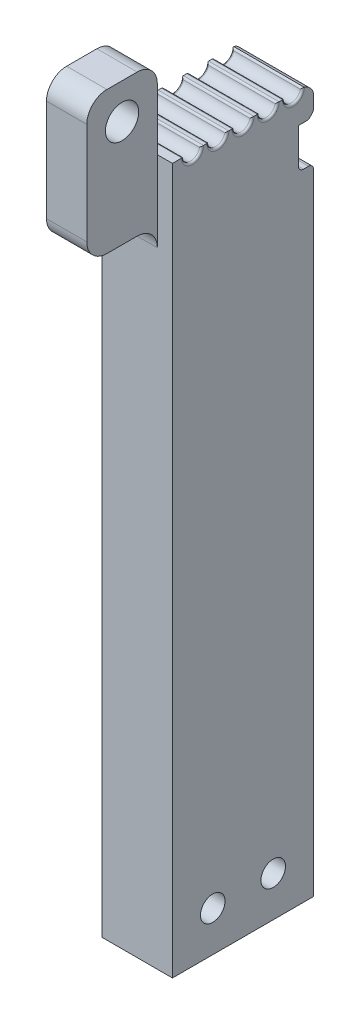
from build123d import *

# Parameters (mm, degrees)
SKETCH1_W                                      = 7
SKETCH1_H                                      = 14
BOSS_EXTRUDE1_DEPTH                            = 70
CBORE_FOR_2_SOCKET_HEAD_CAP_SCREW1_D           = 2.4384
CBORE_FOR_2_SOCKET_HEAD_CAP_SCREW1_CBORE_D     = 4.7625
CBORE_FOR_2_SOCKET_HEAD_CAP_SCREW1_CBORE_DEPTH = 2.1844
CUT_EXTRUDE2_DEPTH                             = 71.696534569
LPATTERN1_COUNT                                = 3
LPATTERN1_PITCH                                = 2.5
LPATTERN1_COL_COUNT                            = 3
LPATTERN1_COL_PITCH                            = 2.5
FILLET1_R                                      = 0.2
CHAMFER1_SIZE                                  = 0.7
FILLET2_R                                      = 1
CUT_EXTRUDE4_DEPTH                             = 71.436141406
CUT_EXTRUDE4_DEPTH_BACK                        = 71.436141406
SKETCH6_W                                      = 1.5
SKETCH6_H                                      = 4
CHAMFER2_SIZE                                  = 0.5
FILLET4_R                                      = 0.5
SKETCH7_W                                      = 7
SKETCH7_H                                      = 14.1
BOSS_EXTRUDE2_DEPTH                            = 2
CUT_EXTRUDE5_REACH                             = 81.535
SKETCH9_R                                      = 1.65
FILLET5_R                                      = 2


with BuildPart() as part:
    # Sketch1 → Boss-Extrude1 (new body)
    with BuildSketch(Plane(origin=(0, 0, 0), x_dir=(1, 0, 0), z_dir=(0, 1, 0))):
        Rectangle(SKETCH1_W, SKETCH1_H)
    extrude(amount=BOSS_EXTRUDE1_DEPTH)

    # CBORE for #2 Socket Head Cap Screw1 (through all)
    with Locations(Plane(origin=(-3.5, 0, 0), x_dir=(0, 0, -1), z_dir=(-1, 0, 0))):
        with Locations((-3, -4), (3, -4)):
            CounterBoreHole(CBORE_FOR_2_SOCKET_HEAD_CAP_SCREW1_D / 2, CBORE_FOR_2_SOCKET_HEAD_CAP_SCREW1_CBORE_D / 2, CBORE_FOR_2_SOCKET_HEAD_CAP_SCREW1_CBORE_DEPTH)

    # Sketch4 → Cut-Extrude2 (cut, through all)
    with BuildSketch(Plane(origin=(3.5, 0, 0), x_dir=(0, 0, -1), z_dir=(1, 0, 0))):
        with BuildLine():
            Line((0.9, 220.888750438), (0.9, 70))
            ThreePointArc((0.9, 70), (0, 69.1), (-0.9, 70))
            Line((-0.9, 70), (-0.9, 220.888750438))
            Line((-0.9, 220.888750438), (-0.9, 522.666251314))
            Line((-0.9, 522.666251314), (0.9, 522.666251314))
            Line((0.9, 522.666251314), (0.9, 220.888750438))
        make_face()
    cut_extrude2 = extrude(amount=-CUT_EXTRUDE2_DEPTH, mode=Mode.SUBTRACT)

    # LPattern1: Cut-Extrude2 ×3
    with Locations(*[(0, 0, i * LPATTERN1_PITCH) for i in range(1, LPATTERN1_COUNT)]):
        add(cut_extrude2, mode=Mode.SUBTRACT)

    # LPattern1 col: Cut-Extrude2 ×3
    with Locations(*[(0, 0, -i * LPATTERN1_COL_PITCH) for i in range(1, LPATTERN1_COL_COUNT)]):
        add(cut_extrude2, mode=Mode.SUBTRACT)

    # Fillet1
    fillet1_edges = [part.edges().sort_by_distance(p)[0] for p in [
        (0, 70, -0.9),
        (0, 70, 0.9),
        (3.5, 69.1, 0),
        (-3.5, 69.1, 0),
        (0, 70, -3.4),
        (0, 70, -1.6),
        (3.5, 69.1, -2.5),
        (-3.5, 69.1, -2.5),
        (0, 70, -5.9),
        (0, 70, -4.1),
        (3.5, 69.1, -5),
        (-3.5, 69.1, -5),
        (0, 70, 1.6),
        (0, 70, 3.4),
        (3.5, 69.1, 2.5),
        (-3.5, 69.1, 2.5),
        (0, 70, 4.1),
        (0, 70, 5.9),
        (3.5, 69.1, 5),
        (-3.5, 69.1, 5),
    ]]
    fillet(fillet1_edges, radius=FILLET1_R)

    # Chamfer1
    chamfer1_edges = [part.edges().sort_by_distance(p)[0] for p in [
        (0, 70, -7),
    ]]
    chamfer(chamfer1_edges, length=CHAMFER1_SIZE)

    # Fillet2
    # the kernel refuses this fillet: 1 mm, written as the material it takes off along each edge
    with BuildSketch(Plane(origin=(-4.535533906, 69.3, -7), x_dir=(0, 0.707106781186555, 0.70710678118654), z_dir=(1, 0, 0))) as fillet2_piece_1:
        with BuildLine():
            CenterArc((FILLET2_R * 0.414213562373, FILLET2_R), FILLET2_R, 225, 45)
            Line((-FILLET2_R * 0.292893218813, FILLET2_R * 0.292893218813), (-FILLET2_R * 0.307035354437, FILLET2_R * 0.27875108319))
            Line((-FILLET2_R * 0.307035354437, FILLET2_R * 0.27875108319), (-FILLET2_R * 0.00828427124746, -FILLET2_R * 0.02))
            Line((-FILLET2_R * 0.00828427124746, -FILLET2_R * 0.02), (FILLET2_R * 0.414213562373, -FILLET2_R * 0.02))
            Line((FILLET2_R * 0.414213562373, -FILLET2_R * 0.02), (FILLET2_R * 0.414213562373, 0))
        make_face()
    extrude(amount=9.071067812, mode=Mode.SUBTRACT)
    with BuildSketch(Plane(origin=(-4.448522012, 70, -6.3), x_dir=(0, 0, 1), z_dir=(1, 0, 0))) as fillet2_piece_2:
        with BuildLine():
            CenterArc((0.438824243, 0.97538932), FILLET2_R, 225, 32.262207343)
            Line((-0.268282539, 0.268282539), (-0.282424674, 0.254140403))
            Line((-0.282424674, 0.254140403), (-0.014142136, -0.014142136))
            Line((-0.014142136, -0.014142136), (0, -0.02))
            ThreePointArc((0, -0.02), (0.109167309, -0.02), (0.213924825, -0.019507786))
            Line((0.213924825, -0.019507786), (0.218334617, 0))
        make_face()
    extrude(amount=8.897044023, mode=Mode.SUBTRACT)

    # Sketch6 → Cut-Extrude4 (cut, two sides: drawn at the far end of the back side and taken through both)
    with BuildSketch(Plane(origin=(0, 0, 0), x_dir=(0, 0, -1), z_dir=(1, 0, 0)).offset(-CUT_EXTRUDE4_DEPTH_BACK)):
        with Locations((6.25, 65)):
            Rectangle(SKETCH6_W, SKETCH6_H)
    extrude(amount=CUT_EXTRUDE4_DEPTH + CUT_EXTRUDE4_DEPTH_BACK, mode=Mode.SUBTRACT)

    # Chamfer2
    chamfer2_edges = [part.edges().sort_by_distance(p)[0] for p in [
        (0, 67, -7),
    ]]
    chamfer(chamfer2_edges, length=CHAMFER2_SIZE)

    # Fillet4
    fillet4_edges = [part.edges().sort_by_distance(p)[0] for p in [
        (0, 63, -7),
        (0, 63, -5.5),
        (0, 67.5, -7),
        (0, 67, -6.5),
    ]]
    fillet(fillet4_edges, radius=FILLET4_R)

    # Sketch7 → Boss-Extrude2 (add, symmetric)
    with BuildSketch(Plane(origin=(0, 0, 0), x_dir=(0, 0, -1), z_dir=(1, 0, 0))):
        with Locations((-10.5, 71.05)):
            Rectangle(SKETCH7_W, SKETCH7_H)
    extrude(amount=BOSS_EXTRUDE2_DEPTH, both=True)

    # Sketch9 → Cut-Extrude5 (cut, up to next)
    with BuildSketch(Plane(origin=(2, 0, 0), x_dir=(0, 0, -1), z_dir=(1, 0, 0)), mode=Mode.PRIVATE) as cut_extrude5_sk1:
        with Locations((-10.5, 74.6)):
            Circle(SKETCH9_R)
    cut_extrude5_tool1 = extrude(cut_extrude5_sk1.sketch, amount=-CUT_EXTRUDE5_REACH, mode=Mode.PRIVATE) & part.part
    add(cut_extrude5_tool1.solids().sort_by_distance((2, 74.6, 10.5))[0], mode=Mode.SUBTRACT)

    # Fillet5
    fillet5_edges = [part.edges().sort_by_distance(p)[0] for p in [
        (0, 78.1, 7),
        (0, 64, 7),
        (0, 64, 14),
        (0, 78.1, 14),
    ]]
    fillet(fillet5_edges, radius=FILLET5_R)


solid = part.part
